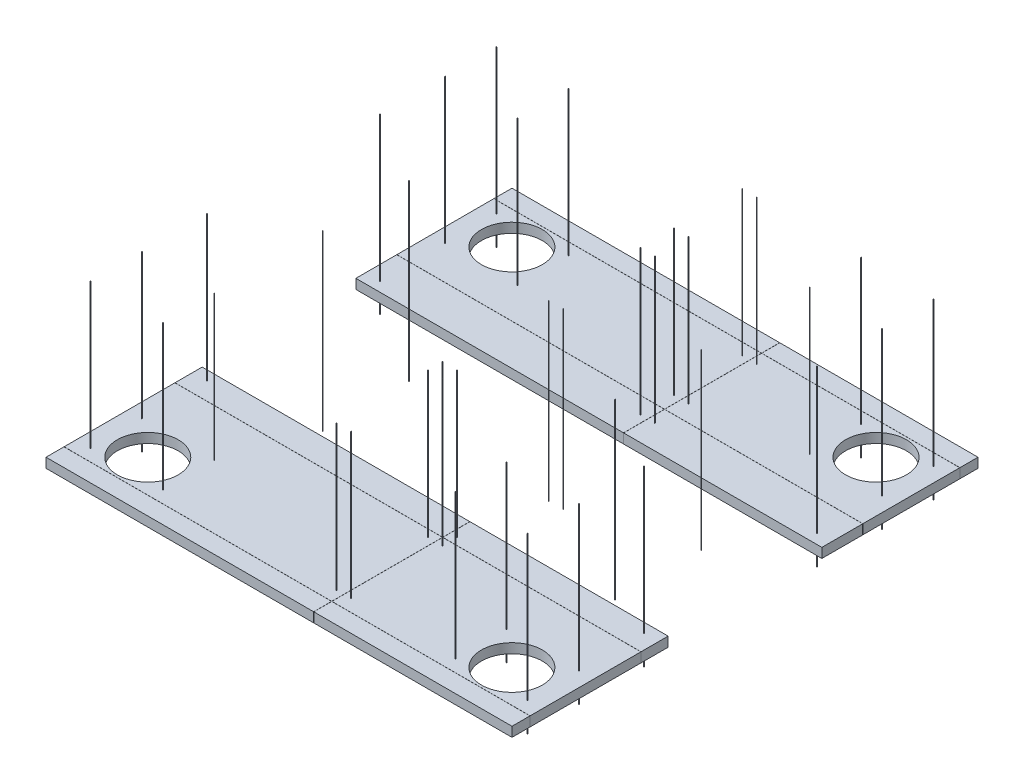
from build123d import *

# Parameters (mm, degrees)
SKETCH1_W                          = 4908.55
SKETCH1_H                          = 4908.55
BOSS_EXTRUDE1_DEPTH                = 101.6
SKETCH2_W                          = 4908.55
SKETCH2_H                          = 1619.25
CUT_EXTRUDE1_DEPTH                 = 3473.355700566
SKETCH4_W                          = 4908.55
SKETCH4_H                          = 1.27
CUT_EXTRUDE_THIN1_DEPTH            = 3473.355700566
CUT_EXTRUDE_THIN2_DEPTH            = 3473.355700566
CUT_EXTRUDE_THIN2_DEPTH_BACK       = 3473.355700566
SKETCH5_W                          = 1.27
SKETCH5_H                          = 4908.55
SKETCH6_R                          = 320.675
DUCT_HOLES_DEPTH                   = 3473.355700566
UNISTRUT_STUD_LAYOUT_DEPTH         = 1524
UNISTRUT_STUD_LAYOUT_DEPTH_BACK    = 304.8
SKETCH7_R                          = 3.175
UNISTRUT_STUD_LAYOUT_2_DEPTH       = 1524
UNISTRUT_STUD_LAYOUT_2_DEPTH_BACK  = 304.8
UNISTRUT_STUD_LAYOUT_3_DEPTH       = 1524
UNISTRUT_STUD_LAYOUT_3_DEPTH_BACK  = 304.8
UNISTRUT_STUD_LAYOUT_4_DEPTH       = 1524
UNISTRUT_STUD_LAYOUT_4_DEPTH_BACK  = 304.8
UNISTRUT_STUD_LAYOUT_5_DEPTH       = 1524
UNISTRUT_STUD_LAYOUT_5_DEPTH_BACK  = 304.8
UNISTRUT_STUD_LAYOUT_6_DEPTH       = 1524
UNISTRUT_STUD_LAYOUT_6_DEPTH_BACK  = 304.8
UNISTRUT_STUD_LAYOUT_7_DEPTH       = 1524
UNISTRUT_STUD_LAYOUT_7_DEPTH_BACK  = 304.8
UNISTRUT_STUD_LAYOUT_8_DEPTH       = 1524
UNISTRUT_STUD_LAYOUT_8_DEPTH_BACK  = 304.8
UNISTRUT_STUD_LAYOUT_9_DEPTH       = 1524
UNISTRUT_STUD_LAYOUT_9_DEPTH_BACK  = 304.8
UNISTRUT_STUD_LAYOUT_10_DEPTH      = 1524
UNISTRUT_STUD_LAYOUT_10_DEPTH_BACK = 304.8
UNISTRUT_STUD_LAYOUT_11_DEPTH      = 1524
UNISTRUT_STUD_LAYOUT_11_DEPTH_BACK = 304.8
UNISTRUT_STUD_LAYOUT_12_DEPTH      = 1524
UNISTRUT_STUD_LAYOUT_12_DEPTH_BACK = 304.8
UNISTRUT_STUD_LAYOUT_13_DEPTH      = 1524
UNISTRUT_STUD_LAYOUT_13_DEPTH_BACK = 304.8
UNISTRUT_STUD_LAYOUT_14_DEPTH      = 1524
UNISTRUT_STUD_LAYOUT_14_DEPTH_BACK = 304.8
UNISTRUT_STUD_LAYOUT_15_DEPTH      = 1524
UNISTRUT_STUD_LAYOUT_15_DEPTH_BACK = 304.8
UNISTRUT_STUD_LAYOUT_16_DEPTH      = 1524
UNISTRUT_STUD_LAYOUT_16_DEPTH_BACK = 304.8
UNISTRUT_STUD_LAYOUT_17_DEPTH      = 1524
UNISTRUT_STUD_LAYOUT_17_DEPTH_BACK = 304.8
UNISTRUT_STUD_LAYOUT_18_DEPTH      = 1524
UNISTRUT_STUD_LAYOUT_18_DEPTH_BACK = 304.8
UNISTRUT_STUD_LAYOUT_19_DEPTH      = 1524
UNISTRUT_STUD_LAYOUT_19_DEPTH_BACK = 304.8
UNISTRUT_STUD_LAYOUT_20_DEPTH      = 1524
UNISTRUT_STUD_LAYOUT_20_DEPTH_BACK = 304.8
UNISTRUT_STUD_LAYOUT_21_DEPTH      = 1524
UNISTRUT_STUD_LAYOUT_21_DEPTH_BACK = 304.8
UNISTRUT_STUD_LAYOUT_22_DEPTH      = 1524
UNISTRUT_STUD_LAYOUT_22_DEPTH_BACK = 304.8
UNISTRUT_STUD_LAYOUT_23_DEPTH      = 1524
UNISTRUT_STUD_LAYOUT_23_DEPTH_BACK = 304.8
UNISTRUT_STUD_LAYOUT_24_DEPTH      = 1524
UNISTRUT_STUD_LAYOUT_24_DEPTH_BACK = 304.8


with BuildPart() as part:
    # Sketch1 → Boss-Extrude1 (new body)
    with BuildSketch(Plane(origin=(0, 0, 0), x_dir=(1, 0, 0), z_dir=(0, 1, 0))):
        Rectangle(SKETCH1_W, SKETCH1_H)
    extrude(amount=BOSS_EXTRUDE1_DEPTH)

    # Sketch2 → Cut-Extrude1 (cut, through all)
    with BuildSketch(Plane(origin=(0, 101.6, 0), x_dir=(1, 0, 0), z_dir=(0, 1, 0))):
        Rectangle(SKETCH2_W, SKETCH2_H)
    extrude(amount=-CUT_EXTRUDE1_DEPTH, mode=Mode.SUBTRACT)


with BuildPart() as cut_extrude1_piece_1:
    # of the separate pieces the step leaves, piece 1, a body of its own (cut_extrude1_pieces)
    add(part.part.solids().sort_by_distance((-2454.275, 0, -2454.275))[0])


with BuildPart() as cut_extrude1_piece_2:
    # of the separate pieces the step leaves, piece 2, a body of its own (cut_extrude1_pieces)
    add(part.part.solids().sort_by_distance((-2454.275, 0, 2454.275))[0])


with BuildPart() as cut_extrude_thin1_tool:
    # Sketch4 → Cut-Extrude-Thin1 (new, through all)
    with BuildSketch(Plane(origin=(0, 101.6, 0), x_dir=(1, 0, 0), z_dir=(0, 1, 0))):
        with Locations((0, -2264.41)):
            Rectangle(SKETCH4_W, SKETCH4_H)
        with Locations((0, -1096.01)):
            Rectangle(SKETCH4_W, SKETCH4_H)
        with Locations((0, 2263.14)):
            Rectangle(SKETCH4_W, SKETCH4_H)
        with Locations((0, 1240.79)):
            Rectangle(SKETCH4_W, SKETCH4_H)
    extrude(amount=-CUT_EXTRUDE_THIN1_DEPTH)


with BuildPart() as cut_extrude1_piece_1_1:
    add(cut_extrude1_piece_1.part)

    # Cut-Extrude-Thin1: cut by cut_extrude_thin1_tool
    add(cut_extrude_thin1_tool.part, mode=Mode.SUBTRACT)


with BuildPart() as cut_extrude1_piece_2_1:
    add(cut_extrude1_piece_2.part)

    # Cut-Extrude-Thin1: cut by cut_extrude_thin1_tool
    add(cut_extrude_thin1_tool.part, mode=Mode.SUBTRACT)


with BuildPart() as cut_extrude_thin1_piece_1:
    # of the separate pieces the step leaves, piece 1, a body of its own (cut_extrude_thin1_pieces)
    add(cut_extrude1_piece_1_1.part.solids().sort_by_distance((-2454.275, 0, -1241.425))[0])


with BuildPart() as cut_extrude_thin1_piece_2:
    # of the separate pieces the step leaves, piece 2, a body of its own (cut_extrude_thin1_pieces)
    add(cut_extrude1_piece_1_1.part.solids().sort_by_distance((-2454.275, 0, -809.625))[0])


with BuildPart() as cut_extrude_thin1_piece_3:
    # of the separate pieces the step leaves, piece 3, a body of its own (cut_extrude_thin1_pieces)
    add(cut_extrude1_piece_1_1.part.solids().sort_by_distance((-2454.275, 0, -2454.275))[0])


with BuildPart() as cut_extrude_thin1_piece_1_of_cut_extrude:
    # of the separate pieces the step leaves, piece 1, a body of its own (cut_extrude_thin1_pieces_of_cut_extrude1)
    add(cut_extrude1_piece_2_1.part.solids().sort_by_distance((-2454.275, 0, 2263.775))[0])


with BuildPart() as cut_extrude_thin1_piece_2_of_cut_extrude:
    # of the separate pieces the step leaves, piece 2, a body of its own (cut_extrude_thin1_pieces_of_cut_extrude1)
    add(cut_extrude1_piece_2_1.part.solids().sort_by_distance((-2454.275, 0, 1095.375))[0])


with BuildPart() as cut_extrude_thin1_piece_3_of_cut_extrude:
    # of the separate pieces the step leaves, piece 3, a body of its own (cut_extrude_thin1_pieces_of_cut_extrude1)
    add(cut_extrude1_piece_2_1.part.solids().sort_by_distance((-2454.275, 0, 2454.275))[0])


with BuildPart() as cut_extrude_thin2_tool:
    # Sketch5 → Cut-Extrude-Thin2 (new, two sides: drawn at the far end of the back side and taken through both)
    with BuildSketch(Plane(origin=(0, 101.6, 0), x_dir=(1, 0, 0), z_dir=(0, 1, 0)).offset(-CUT_EXTRUDE_THIN2_DEPTH_BACK)):
        with Locations((365.76, 0)):
            Rectangle(SKETCH5_W, SKETCH5_H)
    extrude(amount=CUT_EXTRUDE_THIN2_DEPTH + CUT_EXTRUDE_THIN2_DEPTH_BACK)


with BuildPart() as cut_extrude_thin1_piece_1_1:
    add(cut_extrude_thin1_piece_1.part)

    # Cut-Extrude-Thin2: cut by cut_extrude_thin2_tool
    add(cut_extrude_thin2_tool.part, mode=Mode.SUBTRACT)


with BuildPart() as cut_extrude_thin1_piece_2_1:
    add(cut_extrude_thin1_piece_2.part)

    # Cut-Extrude-Thin2: cut by cut_extrude_thin2_tool
    add(cut_extrude_thin2_tool.part, mode=Mode.SUBTRACT)


with BuildPart() as cut_extrude_thin1_piece_3_1:
    add(cut_extrude_thin1_piece_3.part)

    # Cut-Extrude-Thin2: cut by cut_extrude_thin2_tool
    add(cut_extrude_thin2_tool.part, mode=Mode.SUBTRACT)


with BuildPart() as cut_extrude_thin1_piece_1_of_cut_extrude_1:
    add(cut_extrude_thin1_piece_1_of_cut_extrude.part)

    # Cut-Extrude-Thin2: cut by cut_extrude_thin2_tool
    add(cut_extrude_thin2_tool.part, mode=Mode.SUBTRACT)


with BuildPart() as cut_extrude_thin1_piece_2_of_cut_extrude_1:
    add(cut_extrude_thin1_piece_2_of_cut_extrude.part)

    # Cut-Extrude-Thin2: cut by cut_extrude_thin2_tool
    add(cut_extrude_thin2_tool.part, mode=Mode.SUBTRACT)


with BuildPart() as cut_extrude_thin1_piece_3_of_cut_extrude_1:
    add(cut_extrude_thin1_piece_3_of_cut_extrude.part)

    # Cut-Extrude-Thin2: cut by cut_extrude_thin2_tool
    add(cut_extrude_thin2_tool.part, mode=Mode.SUBTRACT)


with BuildPart() as cut_extrude_thin2_piece_1:
    # of the separate pieces the step leaves, piece 1, a body of its own (cut_extrude_thin2_pieces)
    add(cut_extrude_thin1_piece_1_1.part.solids().sort_by_distance((-2454.275, 0, -1241.425))[0])


with BuildPart() as cut_extrude_thin2_piece_2:
    # of the separate pieces the step leaves, piece 2, a body of its own (cut_extrude_thin2_pieces)
    add(cut_extrude_thin1_piece_1_1.part.solids().sort_by_distance((2454.275, 0, -2262.505))[0])


with BuildPart() as cut_extrude_thin2_piece_1_of_cut_extrude:
    # of the separate pieces the step leaves, piece 1, a body of its own (cut_extrude_thin2_pieces_of_cut_extrude)
    add(cut_extrude_thin1_piece_2_1.part.solids().sort_by_distance((-2454.275, 0, -809.625))[0])


with BuildPart() as cut_extrude_thin2_piece_2_of_cut_extrude:
    # of the separate pieces the step leaves, piece 2, a body of its own (cut_extrude_thin2_pieces_of_cut_extrude)
    add(cut_extrude_thin1_piece_2_1.part.solids().sort_by_distance((2454.275, 0, -1240.155))[0])


with BuildPart() as cut_extrude_thin2_piece_1_of_cut_ext_2:
    # of the separate pieces the step leaves, piece 1, a body of its own (cut_extrude_thin2_pieces_of_cut_extr_2)
    add(cut_extrude_thin1_piece_3_1.part.solids().sort_by_distance((-2454.275, 0, -2454.275))[0])


with BuildPart() as cut_extrude_thin2_piece_2_of_cut_ext_2:
    # of the separate pieces the step leaves, piece 2, a body of its own (cut_extrude_thin2_pieces_of_cut_extr_2)
    add(cut_extrude_thin1_piece_3_1.part.solids().sort_by_distance((366.395, 0, -2454.275))[0])


with BuildPart() as cut_extrude_thin2_piece_1_of_cut_ext_3:
    # of the separate pieces the step leaves, piece 1, a body of its own (cut_extrude_thin2_pieces_of_cut_extr_3)
    add(cut_extrude_thin1_piece_1_of_cut_extrude_1.part.solids().sort_by_distance((-2454.275, 0, 2263.775))[0])


with BuildPart() as cut_extrude_thin2_piece_2_of_cut_ext_3:
    # of the separate pieces the step leaves, piece 2, a body of its own (cut_extrude_thin2_pieces_of_cut_extr_3)
    add(cut_extrude_thin1_piece_1_of_cut_extrude_1.part.solids().sort_by_distance((2454.275, 0, 1096.645))[0])


with BuildPart() as cut_extrude_thin2_piece_1_of_cut_ext_4:
    # of the separate pieces the step leaves, piece 1, a body of its own (cut_extrude_thin2_pieces_of_cut_extr_4)
    add(cut_extrude_thin1_piece_2_of_cut_extrude_1.part.solids().sort_by_distance((-2454.275, 0, 1095.375))[0])


with BuildPart() as cut_extrude_thin2_piece_2_of_cut_ext_4:
    # of the separate pieces the step leaves, piece 2, a body of its own (cut_extrude_thin2_pieces_of_cut_extr_4)
    add(cut_extrude_thin1_piece_2_of_cut_extrude_1.part.solids().sort_by_distance((2454.275, 0, 809.625))[0])


with BuildPart() as cut_extrude_thin2_piece_1_of_cut_ext_5:
    # of the separate pieces the step leaves, piece 1, a body of its own (cut_extrude_thin2_pieces_of_cut_extr_5)
    add(cut_extrude_thin1_piece_3_of_cut_extrude_1.part.solids().sort_by_distance((-2454.275, 0, 2454.275))[0])


with BuildPart() as cut_extrude_thin2_piece_2_of_cut_ext_5:
    # of the separate pieces the step leaves, piece 2, a body of its own (cut_extrude_thin2_pieces_of_cut_extr_5)
    add(cut_extrude_thin1_piece_3_of_cut_extrude_1.part.solids().sort_by_distance((2454.275, 0, 2265.045))[0])


with BuildPart() as duct_holes_tool:
    # Sketch6 → DUCT HOLES (new, through all)
    with BuildSketch(Plane(origin=(0, 101.6, 0), x_dir=(1, 0, 0), z_dir=(0, 1, 0))):
        with Locations((1917.7, 1916.43)):
            Circle(SKETCH6_R)
        with Locations((-1917.7, 1916.43)):
            Circle(SKETCH6_R)
        with Locations((-1917.7, -1918.97)):
            Circle(SKETCH6_R)
        with Locations((1917.7, -1918.97)):
            Circle(SKETCH6_R)
    extrude(amount=-DUCT_HOLES_DEPTH)


with BuildPart() as cut_extrude_thin2_piece_1_1:
    add(cut_extrude_thin2_piece_1.part)

    # DUCT HOLES: cut by duct_holes_tool
    add(duct_holes_tool.part, mode=Mode.SUBTRACT)


with BuildPart() as cut_extrude_thin2_piece_2_1:
    add(cut_extrude_thin2_piece_2.part)

    # DUCT HOLES: cut by duct_holes_tool
    add(duct_holes_tool.part, mode=Mode.SUBTRACT)


with BuildPart() as cut_extrude_thin2_piece_1_of_cut_ext_3_1:
    add(cut_extrude_thin2_piece_1_of_cut_ext_3.part)

    # DUCT HOLES: cut by duct_holes_tool
    add(duct_holes_tool.part, mode=Mode.SUBTRACT)


with BuildPart() as cut_extrude_thin2_piece_2_of_cut_ext_3_1:
    add(cut_extrude_thin2_piece_2_of_cut_ext_3.part)

    # DUCT HOLES: cut by duct_holes_tool
    add(duct_holes_tool.part, mode=Mode.SUBTRACT)


with BuildPart() as body_13:
    # Sketch7 → UNISTRUT STUD LAYOUT (new, two sides: drawn at the far end of the back side and taken through both)
    with BuildSketch(Plane(origin=(0, 101.6, 0), x_dir=(1, 0, 0), z_dir=(0, 1, 0)).offset(-UNISTRUT_STUD_LAYOUT_DEPTH_BACK)):
        with Locations((1539.875, 1597.025)):
            Circle(SKETCH7_R)
    extrude(amount=UNISTRUT_STUD_LAYOUT_DEPTH + UNISTRUT_STUD_LAYOUT_DEPTH_BACK)


with BuildPart() as body_14:
    # Sketch7 → UNISTRUT STUD LAYOUT 2 (new, two sides: drawn at the far end of the back side and taken through both)
    with BuildSketch(Plane(origin=(0, 101.6, 0), x_dir=(1, 0, 0), z_dir=(0, 1, 0)).offset(-UNISTRUT_STUD_LAYOUT_2_DEPTH_BACK)):
        with Locations((-1539.875, 1597.025)):
            Circle(SKETCH7_R)
    extrude(amount=UNISTRUT_STUD_LAYOUT_2_DEPTH + UNISTRUT_STUD_LAYOUT_2_DEPTH_BACK)


with BuildPart() as body_15:
    # Sketch7 → UNISTRUT STUD LAYOUT 3 (new, two sides: drawn at the far end of the back side and taken through both)
    with BuildSketch(Plane(origin=(0, 101.6, 0), x_dir=(1, 0, 0), z_dir=(0, 1, 0)).offset(-UNISTRUT_STUD_LAYOUT_3_DEPTH_BACK)):
        with Locations((441.325, 1063.625)):
            Circle(SKETCH7_R)
    extrude(amount=UNISTRUT_STUD_LAYOUT_3_DEPTH + UNISTRUT_STUD_LAYOUT_3_DEPTH_BACK)


with BuildPart() as body_16:
    # Sketch7 → UNISTRUT STUD LAYOUT 4 (new, two sides: drawn at the far end of the back side and taken through both)
    with BuildSketch(Plane(origin=(0, 101.6, 0), x_dir=(1, 0, 0), z_dir=(0, 1, 0)).offset(-UNISTRUT_STUD_LAYOUT_4_DEPTH_BACK)):
        with Locations((-1539.875, 2136.775)):
            Circle(SKETCH7_R)
    extrude(amount=UNISTRUT_STUD_LAYOUT_4_DEPTH + UNISTRUT_STUD_LAYOUT_4_DEPTH_BACK)


with BuildPart() as body_17:
    # Sketch7 → UNISTRUT STUD LAYOUT 5 (new, two sides: drawn at the far end of the back side and taken through both)
    with BuildSketch(Plane(origin=(0, 101.6, 0), x_dir=(1, 0, 0), z_dir=(0, 1, 0)).offset(-UNISTRUT_STUD_LAYOUT_5_DEPTH_BACK)):
        with Locations((1539.875, 2136.775)):
            Circle(SKETCH7_R)
    extrude(amount=UNISTRUT_STUD_LAYOUT_5_DEPTH + UNISTRUT_STUD_LAYOUT_5_DEPTH_BACK)


with BuildPart() as body_18:
    # Sketch7 → UNISTRUT STUD LAYOUT 6 (new, two sides: drawn at the far end of the back side and taken through both)
    with BuildSketch(Plane(origin=(0, 101.6, 0), x_dir=(1, 0, 0), z_dir=(0, 1, 0)).offset(-UNISTRUT_STUD_LAYOUT_6_DEPTH_BACK)):
        with Locations((-2301.875, 1597.025)):
            Circle(SKETCH7_R)
    extrude(amount=UNISTRUT_STUD_LAYOUT_6_DEPTH + UNISTRUT_STUD_LAYOUT_6_DEPTH_BACK)


with BuildPart() as body_19:
    # Sketch7 → UNISTRUT STUD LAYOUT 7 (new, two sides: drawn at the far end of the back side and taken through both)
    with BuildSketch(Plane(origin=(0, 101.6, 0), x_dir=(1, 0, 0), z_dir=(0, 1, 0)).offset(-UNISTRUT_STUD_LAYOUT_7_DEPTH_BACK)):
        with Locations((2301.875, 1597.025)):
            Circle(SKETCH7_R)
    extrude(amount=UNISTRUT_STUD_LAYOUT_7_DEPTH + UNISTRUT_STUD_LAYOUT_7_DEPTH_BACK)


with BuildPart() as body_20:
    # Sketch7 → UNISTRUT STUD LAYOUT 8 (new, two sides: drawn at the far end of the back side and taken through both)
    with BuildSketch(Plane(origin=(0, 101.6, 0), x_dir=(1, 0, 0), z_dir=(0, 1, 0)).offset(-UNISTRUT_STUD_LAYOUT_8_DEPTH_BACK)):
        with Locations((-2301.875, 2136.775)):
            Circle(SKETCH7_R)
    extrude(amount=UNISTRUT_STUD_LAYOUT_8_DEPTH + UNISTRUT_STUD_LAYOUT_8_DEPTH_BACK)


with BuildPart() as body_21:
    # Sketch7 → UNISTRUT STUD LAYOUT 9 (new, two sides: drawn at the far end of the back side and taken through both)
    with BuildSketch(Plane(origin=(0, 101.6, 0), x_dir=(1, 0, 0), z_dir=(0, 1, 0)).offset(-UNISTRUT_STUD_LAYOUT_9_DEPTH_BACK)):
        with Locations((2301.875, 2136.775)):
            Circle(SKETCH7_R)
    extrude(amount=UNISTRUT_STUD_LAYOUT_9_DEPTH + UNISTRUT_STUD_LAYOUT_9_DEPTH_BACK)


with BuildPart() as body_22:
    # Sketch7 → UNISTRUT STUD LAYOUT 10 (new, two sides: drawn at the far end of the back side and taken through both)
    with BuildSketch(Plane(origin=(0, 101.6, 0), x_dir=(1, 0, 0), z_dir=(0, 1, 0)).offset(-UNISTRUT_STUD_LAYOUT_10_DEPTH_BACK)):
        with Locations((288.925, 1416.685)):
            Circle(SKETCH7_R)
    extrude(amount=UNISTRUT_STUD_LAYOUT_10_DEPTH + UNISTRUT_STUD_LAYOUT_10_DEPTH_BACK)


with BuildPart() as body_23:
    # Sketch7 → UNISTRUT STUD LAYOUT 11 (new, two sides: drawn at the far end of the back side and taken through both)
    with BuildSketch(Plane(origin=(0, 101.6, 0), x_dir=(1, 0, 0), z_dir=(0, 1, 0)).offset(-UNISTRUT_STUD_LAYOUT_11_DEPTH_BACK)):
        with Locations((441.325, 1416.685)):
            Circle(SKETCH7_R)
    extrude(amount=UNISTRUT_STUD_LAYOUT_11_DEPTH + UNISTRUT_STUD_LAYOUT_11_DEPTH_BACK)


with BuildPart() as body_24:
    # Sketch7 → UNISTRUT STUD LAYOUT 12 (new, two sides: drawn at the far end of the back side and taken through both)
    with BuildSketch(Plane(origin=(0, 101.6, 0), x_dir=(1, 0, 0), z_dir=(0, 1, 0)).offset(-UNISTRUT_STUD_LAYOUT_12_DEPTH_BACK)):
        with Locations((288.925, 1063.625)):
            Circle(SKETCH7_R)
    extrude(amount=UNISTRUT_STUD_LAYOUT_12_DEPTH + UNISTRUT_STUD_LAYOUT_12_DEPTH_BACK)


with BuildPart() as body_25:
    # Sketch7 → UNISTRUT STUD LAYOUT 13 (new, two sides: drawn at the far end of the back side and taken through both)
    with BuildSketch(Plane(origin=(0, 101.6, 0), x_dir=(1, 0, 0), z_dir=(0, 1, 0)).offset(-UNISTRUT_STUD_LAYOUT_13_DEPTH_BACK)):
        with Locations((441.325, -1020.445)):
            Circle(SKETCH7_R)
    extrude(amount=UNISTRUT_STUD_LAYOUT_13_DEPTH + UNISTRUT_STUD_LAYOUT_13_DEPTH_BACK)


with BuildPart() as body_26:
    # Sketch7 → UNISTRUT STUD LAYOUT 14 (new, two sides: drawn at the far end of the back side and taken through both)
    with BuildSketch(Plane(origin=(0, 101.6, 0), x_dir=(1, 0, 0), z_dir=(0, 1, 0)).offset(-UNISTRUT_STUD_LAYOUT_14_DEPTH_BACK)):
        with Locations((288.925, -1020.445)):
            Circle(SKETCH7_R)
    extrude(amount=UNISTRUT_STUD_LAYOUT_14_DEPTH + UNISTRUT_STUD_LAYOUT_14_DEPTH_BACK)


with BuildPart() as body_27:
    # Sketch7 → UNISTRUT STUD LAYOUT 15 (new, two sides: drawn at the far end of the back side and taken through both)
    with BuildSketch(Plane(origin=(0, 101.6, 0), x_dir=(1, 0, 0), z_dir=(0, 1, 0)).offset(-UNISTRUT_STUD_LAYOUT_15_DEPTH_BACK)):
        with Locations((288.925, -1172.845)):
            Circle(SKETCH7_R)
    extrude(amount=UNISTRUT_STUD_LAYOUT_15_DEPTH + UNISTRUT_STUD_LAYOUT_15_DEPTH_BACK)


with BuildPart() as body_28:
    # Sketch7 → UNISTRUT STUD LAYOUT 16 (new, two sides: drawn at the far end of the back side and taken through both)
    with BuildSketch(Plane(origin=(0, 101.6, 0), x_dir=(1, 0, 0), z_dir=(0, 1, 0)).offset(-UNISTRUT_STUD_LAYOUT_16_DEPTH_BACK)):
        with Locations((441.325, -1172.845)):
            Circle(SKETCH7_R)
    extrude(amount=UNISTRUT_STUD_LAYOUT_16_DEPTH + UNISTRUT_STUD_LAYOUT_16_DEPTH_BACK)


with BuildPart() as body_29:
    # Sketch7 → UNISTRUT STUD LAYOUT 17 (new, two sides: drawn at the far end of the back side and taken through both)
    with BuildSketch(Plane(origin=(0, 101.6, 0), x_dir=(1, 0, 0), z_dir=(0, 1, 0)).offset(-UNISTRUT_STUD_LAYOUT_17_DEPTH_BACK)):
        with Locations((-2301.875, 911.225)):
            Circle(SKETCH7_R)
    extrude(amount=UNISTRUT_STUD_LAYOUT_17_DEPTH + UNISTRUT_STUD_LAYOUT_17_DEPTH_BACK)


with BuildPart() as body_30:
    # Sketch7 → UNISTRUT STUD LAYOUT 18 (new, two sides: drawn at the far end of the back side and taken through both)
    with BuildSketch(Plane(origin=(0, 101.6, 0), x_dir=(1, 0, 0), z_dir=(0, 1, 0)).offset(-UNISTRUT_STUD_LAYOUT_18_DEPTH_BACK)):
        with Locations((2301.875, 911.225)):
            Circle(SKETCH7_R)
    extrude(amount=UNISTRUT_STUD_LAYOUT_18_DEPTH + UNISTRUT_STUD_LAYOUT_18_DEPTH_BACK)


with BuildPart() as body_31:
    # Sketch7 → UNISTRUT STUD LAYOUT 19 (new, two sides: drawn at the far end of the back side and taken through both)
    with BuildSketch(Plane(origin=(0, 101.6, 0), x_dir=(1, 0, 0), z_dir=(0, 1, 0)).offset(-UNISTRUT_STUD_LAYOUT_19_DEPTH_BACK)):
        with Locations((1539.875, 454.025)):
            Circle(SKETCH7_R)
    extrude(amount=UNISTRUT_STUD_LAYOUT_19_DEPTH + UNISTRUT_STUD_LAYOUT_19_DEPTH_BACK)


with BuildPart() as body_32:
    # Sketch7 → UNISTRUT STUD LAYOUT 20 (new, two sides: drawn at the far end of the back side and taken through both)
    with BuildSketch(Plane(origin=(0, 101.6, 0), x_dir=(1, 0, 0), z_dir=(0, 1, 0)).offset(-UNISTRUT_STUD_LAYOUT_20_DEPTH_BACK)):
        with Locations((-1539.875, 454.025)):
            Circle(SKETCH7_R)
    extrude(amount=UNISTRUT_STUD_LAYOUT_20_DEPTH + UNISTRUT_STUD_LAYOUT_20_DEPTH_BACK)


with BuildPart() as body_33:
    # Sketch7 → UNISTRUT STUD LAYOUT 21 (new, two sides: drawn at the far end of the back side and taken through both)
    with BuildSketch(Plane(origin=(0, 101.6, 0), x_dir=(1, 0, 0), z_dir=(0, 1, 0)).offset(-UNISTRUT_STUD_LAYOUT_21_DEPTH_BACK)):
        with Locations((441.325, 98.425)):
            Circle(SKETCH7_R)
    extrude(amount=UNISTRUT_STUD_LAYOUT_21_DEPTH + UNISTRUT_STUD_LAYOUT_21_DEPTH_BACK)


with BuildPart() as body_34:
    # Sketch7 → UNISTRUT STUD LAYOUT 22 (new, two sides: drawn at the far end of the back side and taken through both)
    with BuildSketch(Plane(origin=(0, 101.6, 0), x_dir=(1, 0, 0), z_dir=(0, 1, 0)).offset(-UNISTRUT_STUD_LAYOUT_22_DEPTH_BACK)):
        with Locations((288.925, 98.425)):
            Circle(SKETCH7_R)
    extrude(amount=UNISTRUT_STUD_LAYOUT_22_DEPTH + UNISTRUT_STUD_LAYOUT_22_DEPTH_BACK)


with BuildPart() as body_35:
    # Sketch7 → UNISTRUT STUD LAYOUT 23 (new, two sides: drawn at the far end of the back side and taken through both)
    with BuildSketch(Plane(origin=(0, 101.6, 0), x_dir=(1, 0, 0), z_dir=(0, 1, 0)).offset(-UNISTRUT_STUD_LAYOUT_23_DEPTH_BACK)):
        with Locations((288.925, 2136.775)):
            Circle(SKETCH7_R)
    extrude(amount=UNISTRUT_STUD_LAYOUT_23_DEPTH + UNISTRUT_STUD_LAYOUT_23_DEPTH_BACK)


with BuildPart() as body_36:
    # Sketch7 → UNISTRUT STUD LAYOUT 24 (new, two sides: drawn at the far end of the back side and taken through both)
    with BuildSketch(Plane(origin=(0, 101.6, 0), x_dir=(1, 0, 0), z_dir=(0, 1, 0)).offset(-UNISTRUT_STUD_LAYOUT_24_DEPTH_BACK)):
        with Locations((441.325, 2136.775)):
            Circle(SKETCH7_R)
    extrude(amount=UNISTRUT_STUD_LAYOUT_24_DEPTH + UNISTRUT_STUD_LAYOUT_24_DEPTH_BACK)


with BuildPart() as body_37:
    # Mirror3: mirrored copy
    add(body_18.part.mirror(Plane.XY))


with BuildPart() as body_38:
    # Mirror3 2: mirrored copy
    add(body_14.part.mirror(Plane.XY))


with BuildPart() as body_39:
    # Mirror3 3: mirrored copy
    add(body_16.part.mirror(Plane.XY))


with BuildPart() as body_40:
    # Mirror3 4: mirrored copy
    add(body_13.part.mirror(Plane.XY))


with BuildPart() as body_41:
    # Mirror3 5: mirrored copy
    add(body_17.part.mirror(Plane.XY))


with BuildPart() as body_42:
    # Mirror3 6: mirrored copy
    add(body_19.part.mirror(Plane.XY))


with BuildPart() as body_43:
    # Mirror3 7: mirrored copy
    add(body_20.part.mirror(Plane.XY))


with BuildPart() as body_44:
    # Mirror3 8: mirrored copy
    add(body_21.part.mirror(Plane.XY))


with BuildPart() as body_45:
    # Mirror3 9: mirrored copy
    add(body_30.part.mirror(Plane.XY))


with BuildPart() as body_46:
    # Mirror3 10: mirrored copy
    add(body_29.part.mirror(Plane.XY))


with BuildPart() as body_47:
    # Mirror3 11: mirrored copy
    add(body_32.part.mirror(Plane.XY))


with BuildPart() as body_48:
    # Mirror3 12: mirrored copy
    add(body_31.part.mirror(Plane.XY))


with BuildPart() as body_49:
    # Mirror3 13: mirrored copy
    add(body_35.part.mirror(Plane.XY))


with BuildPart() as body_50:
    # Mirror3 14: mirrored copy
    add(body_36.part.mirror(Plane.XY))


solid = Compound([cut_extrude_thin2_piece_1_of_cut_extrude.part, cut_extrude_thin2_piece_2_of_cut_extrude.part, cut_extrude_thin2_piece_1_of_cut_ext_2.part, cut_extrude_thin2_piece_2_of_cut_ext_2.part, cut_extrude_thin2_piece_1_of_cut_ext_4.part, cut_extrude_thin2_piece_2_of_cut_ext_4.part, cut_extrude_thin2_piece_1_of_cut_ext_5.part, cut_extrude_thin2_piece_2_of_cut_ext_5.part, cut_extrude_thin2_piece_1_1.part, cut_extrude_thin2_piece_2_1.part, cut_extrude_thin2_piece_1_of_cut_ext_3_1.part, cut_extrude_thin2_piece_2_of_cut_ext_3_1.part, body_13.part, body_14.part, body_15.part, body_16.part, body_17.part, body_18.part, body_19.part, body_20.part, body_21.part, body_22.part, body_23.part, body_24.part, body_25.part, body_26.part, body_27.part, body_28.part, body_29.part, body_30.part, body_31.part, body_32.part, body_33.part, body_34.part, body_35.part, body_36.part, body_37.part, body_38.part, body_39.part, body_40.part, body_41.part, body_42.part, body_43.part, body_44.part, body_45.part, body_46.part, body_47.part, body_48.part, body_49.part, body_50.part])
